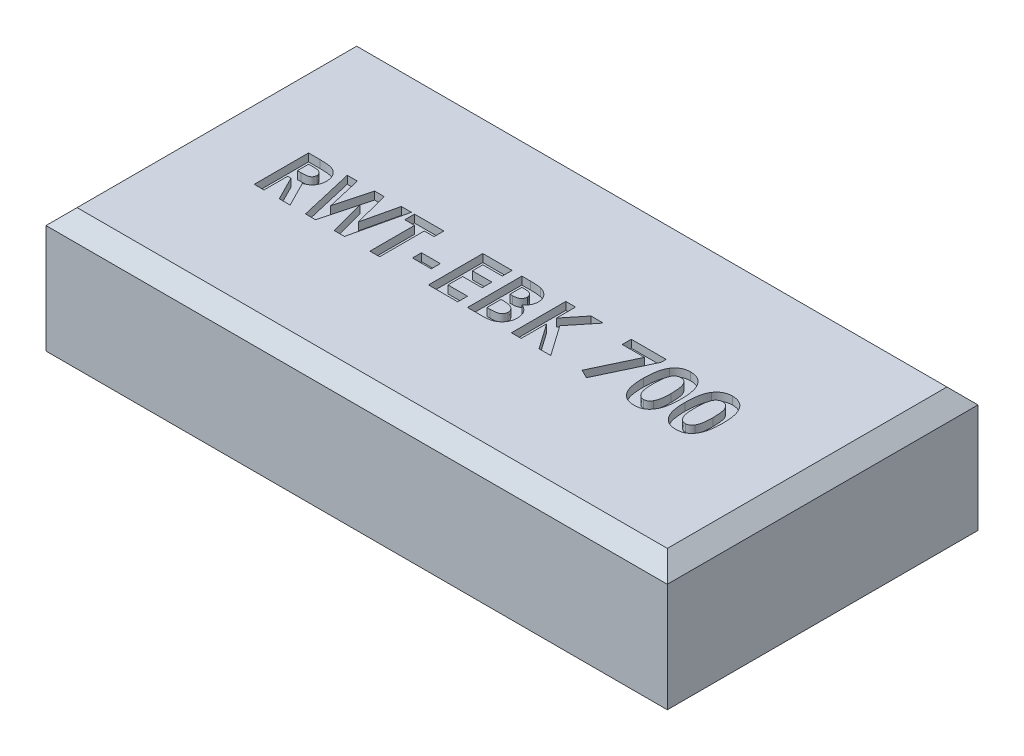
from build123d import *

# Parameters (mm, degrees)
SKETCH1_W           = 40
SKETCH1_H           = 20
BOSS_EXTRUDE1_DEPTH = 8
CHAMFER1_SIZE       = 1
SKETCH4_W           = 1.211538461
SKETCH4_H           = 0.583333333
CUT_EXTRUDE3_DEPTH  = 0.5


with BuildPart() as part:
    # Sketch1 → Boss-Extrude1 (new body)
    with BuildSketch(Plane(origin=(0, 0, 0), x_dir=(1, 0, 0), z_dir=(0, 1, 0))):
        with Locations((0, 2.318501171)):
            Rectangle(SKETCH1_W, SKETCH1_H)
    extrude(amount=BOSS_EXTRUDE1_DEPTH)

    # Chamfer1
    chamfer1_edges = [part.edges().sort_by_distance(p)[0] for p in [
        (0, 8, 7.681498829),
        (-20, 8, -2.318501171),
        (0, 8, -12.318501171),
        (20, 8, -2.318501171),
    ]]
    chamfer(chamfer1_edges, length=CHAMFER1_SIZE)

    # Sketch4 → Cut-Extrude3 (cut)
    # profile 1 of 10: a face of its own
    with BuildSketch(Plane(origin=(0, 8, 0), x_dir=(1, 0, 0), z_dir=(0, 1, 0))):
        with BuildLine():
            Line((-14.596153846, 3.818501171), (-13.864182692, 3.818501171))
            add(Edge.make_bspline(
                [(-13.864182692, 3.818501171), (-13.815799622, 3.818329439), (-13.722745349, 3.81799915), (-13.588566169, 3.81278806), (-13.46530414, 3.805536401), (-13.352776761, 3.794470177), (-13.251032173, 3.779797701), (-13.159968404, 3.76250128), (-13.079588115, 3.742788301), (-13.009213411, 3.718224373), (-12.945703721, 3.690516634), (-12.886503859, 3.658679935), (-12.830307791, 3.623068786), (-12.777491125, 3.582746162), (-12.727594872, 3.538437457), (-12.6805249, 3.49009807), (-12.636946351, 3.437318103), (-12.597129066, 3.380431058), (-12.560838815, 3.320587191), (-12.528765845, 3.257704336), (-12.502684052, 3.191738763), (-12.479637993, 3.123643816), (-12.463038663, 3.052446065), (-12.451494071, 2.978838632), (-12.443041573, 2.902562411), (-12.442555595, 2.850743733), (-12.442307692, 2.824310466)],
                knots=[0, 0, 0, 0, 1.749336639, 3.364467119, 4.854658419, 6.213483162, 7.451590619, 8.570285859, 9.5643256, 10.440900261, 11.26203566, 12.067320669, 12.869050712, 13.665104639, 14.467235401, 15.27997916, 16.102287765, 16.939272006, 17.78853747, 18.631303466, 19.488103222, 20.351255419, 21.228522269, 22.127379805, 23.044756219, 24, 24, 24, 24], degree=3))
            add(Edge.make_bspline(
                [(-12.442307692, 2.824310466), (-12.442951654, 2.796720207), (-12.444214347, 2.742620739), (-12.451015895, 2.663153032), (-12.46344699, 2.587123888), (-12.48227569, 2.514755912), (-12.503916836, 2.4451484), (-12.532694008, 2.379585653), (-12.565171892, 2.317114157), (-12.603744925, 2.258617595), (-12.646076944, 2.20279664), (-12.695308193, 2.151790002), (-12.748249241, 2.102856265), (-12.807876098, 2.059060474), (-12.871560358, 2.017441316), (-12.940567358, 1.979723274), (-13.014446736, 1.944958206), (-13.066387598, 1.925570802), (-13.092948718, 1.91565662)],
                knots=[0, 0, 0, 0, 1.099860209, 2.156625411, 3.176576793, 4.16617041, 5.135385252, 6.078461593, 7.016046972, 7.938469504, 8.868247731, 9.803980173, 10.76021508, 11.73834243, 12.748633912, 13.790971185, 14.870363756, 16, 16, 16, 16], degree=3))
            Line((-13.092948718, 1.91565662), (-12.28525641, 0.318501171))
            Line((-12.28525641, 0.318501171), (-12.983573718, 0.318501171))
            Line((-12.983573718, 0.318501171), (-13.754807692, 1.844142197))
            Line((-13.754807692, 1.844142197), (-13.967948718, 1.844142197))
            Line((-13.967948718, 1.844142197), (-13.967948718, 0.318501171))
            Line((-13.967948718, 0.318501171), (-14.596153846, 0.318501171))
            Line((-14.596153846, 0.318501171), (-14.596153846, 3.818501171))
        make_face()
        with BuildLine():
            Line((-13.967948718, 2.472347325), (-13.723257212, 2.472347325))
            add(Edge.make_bspline(
                [(-13.723257212, 2.472347325), (-13.693341641, 2.472684254), (-13.636059751, 2.473329401), (-13.55368087, 2.476321861), (-13.4788612, 2.483532211), (-13.41127944, 2.492642218), (-13.350595524, 2.503161037), (-13.297350732, 2.518235143), (-13.250724642, 2.534387429), (-13.211269776, 2.554460531), (-13.177560445, 2.577288002), (-13.148454596, 2.603220576), (-13.124379885, 2.633234229), (-13.104565169, 2.666513318), (-13.089151475, 2.70335219), (-13.07790066, 2.743346436), (-13.071613117, 2.786951643), (-13.070889714, 2.817045173), (-13.070512821, 2.832723927)],
                knots=[0, 0, 0, 0, 1.688639943, 3.233382647, 4.650958383, 5.928841754, 7.082724185, 8.122798841, 9.049171256, 9.863274652, 10.613301712, 11.341792392, 12.054588806, 12.776240173, 13.521029143, 14.301969904, 15.115324896, 16, 16, 16, 16], degree=3))
            add(Edge.make_bspline(
                [(-13.070512821, 2.832723927), (-13.071225372, 2.851273039), (-13.072625049, 2.88770933), (-13.086514186, 2.940164814), (-13.108622693, 2.988715953), (-13.1389274, 3.033143381), (-13.177092239, 3.072091531), (-13.220889403, 3.106424636), (-13.27126414, 3.133572687), (-13.317907356, 3.151479252), (-13.36034178, 3.162192934), (-13.398637509, 3.170176676), (-13.442984193, 3.175834983), (-13.493415313, 3.181836624), (-13.549802317, 3.185728385), (-13.612452548, 3.188568594), (-13.681186076, 3.189730664), (-13.729099873, 3.190102157), (-13.754106571, 3.190296043)],
                knots=[0, 0, 0, 0, 1.020303359, 2.004196876, 2.966617323, 3.9489082, 4.950758222, 5.960522915, 7.003732012, 8.091992268, 8.70421221, 9.413913587, 10.24622431, 11.166358409, 12.212345909, 13.359657661, 14.621978493, 16, 16, 16, 16], degree=3))
            Line((-13.754106571, 3.190296043), (-13.967948718, 3.190296043))
            Line((-13.967948718, 3.190296043), (-13.967948718, 2.472347325))
        make_face(mode=Mode.SUBTRACT)
    # profile 2 of 10: a face of its own
    with BuildSketch(Plane(origin=(0, 8, 0), x_dir=(1, 0, 0), z_dir=(0, 1, 0))):
        Polygon((-12.105769231, 3.818501171), (-11.457231571, 3.818501171), (-10.939102564, 1.584026011), (-10.345252404, 3.818501171), (-9.734575321, 3.818501171), (-9.144230769, 1.584026011), (-8.627504006, 3.818501171), (-7.977564103, 3.818501171), (-8.787359776, 0.318501171), (-9.443609776, 0.318501171), (-10.041666667, 2.581021203), (-10.643229167, 0.318501171), (-11.294571314, 0.318501171), align=None)
    # profile 3 of 10: a face of its own
    with BuildSketch(Plane(origin=(0, 8, 0), x_dir=(1, 0, 0), z_dir=(0, 1, 0))):
        Polygon((-7.775641026, 3.818501171), (-5.891025641, 3.818501171), (-5.891025641, 3.190296043), (-6.519230769, 3.190296043), (-6.519230769, 0.318501171), (-7.147435897, 0.318501171), (-7.147435897, 3.190296043), (-7.775641026, 3.190296043), align=None)
    # profile 4 of 10: a face of its own
    with BuildSketch(Plane(origin=(0, 8, 0), x_dir=(1, 0, 0), z_dir=(0, 1, 0))):
        with Locations((-4.791666667, 1.597347325)):
            Rectangle(SKETCH4_W, SKETCH4_H)
    # profile 5 of 10: a face of its own
    with BuildSketch(Plane(origin=(0, 8, 0), x_dir=(1, 0, 0), z_dir=(0, 1, 0))):
        Polygon((-3.378205128, 3.818501171), (-1.493589744, 3.818501171), (-1.493589744, 3.190296043), (-2.75, 3.190296043), (-2.75, 2.51721912), (-1.493589744, 2.51721912), (-1.493589744, 1.889013991), (-2.75, 1.889013991), (-2.75, 0.946706299), (-1.493589744, 0.946706299), (-1.493589744, 0.318501171), (-3.378205128, 0.318501171), align=None)
    # profile 6 of 10: a face of its own
    with BuildSketch(Plane(origin=(0, 8, 0), x_dir=(1, 0, 0), z_dir=(0, 1, 0))):
        with BuildLine():
            Line((-0.865384615, 0.318501171), (-0.865384615, 3.818501171))
            Line((-0.865384615, 3.818501171), (-0.304487179, 3.818501171))
            add(Edge.make_bspline(
                [(-0.304487179, 3.818501171), (-0.265220852, 3.818505652), (-0.189241252, 3.818514323), (-0.079622519, 3.814664873), (0.022039599, 3.809685178), (0.115421572, 3.804114058), (0.200682344, 3.794513904), (0.277692262, 3.784396391), (0.346605192, 3.772195293), (0.389210312, 3.76125053), (0.409254808, 3.756101331)],
                knots=[0, 0, 0, 0, 1.311965854, 2.538629056, 3.664479157, 4.713267157, 5.663616078, 6.530575999, 7.308677837, 8, 8, 8, 8], degree=3))
            add(Edge.make_bspline(
                [(0.409254808, 3.756101331), (0.435575266, 3.748838294), (0.487224455, 3.734585883), (0.561202576, 3.705802524), (0.631381143, 3.673807779), (0.697674471, 3.637307759), (0.759675491, 3.595861807), (0.817148578, 3.549140995), (0.871333285, 3.499020694), (0.920305637, 3.444104065), (0.964568575, 3.386074475), (1.003025131, 3.324947127), (1.03643895, 3.2616567), (1.063178757, 3.195406725), (1.083326699, 3.126502301), (1.09806282, 3.055237661), (1.107613822, 2.981387306), (1.108516267, 2.931144495), (1.108974359, 2.905640594)],
                knots=[0, 0, 0, 0, 1.099996261, 2.158545794, 3.195537121, 4.207578794, 5.205712374, 6.197378256, 7.190519799, 8.17788031, 9.159561366, 10.129234751, 11.085776129, 12.040971148, 13.00380137, 13.975669004, 14.972423361, 16, 16, 16, 16], degree=3))
            add(Edge.make_bspline(
                [(1.108974359, 2.905640594), (1.107776583, 2.872874775), (1.105418909, 2.808379286), (1.090357925, 2.713647082), (1.062116233, 2.624111532), (1.025162666, 2.538122532), (0.974917368, 2.456000819), (0.911115557, 2.377785442), (0.834790614, 2.30106803), (0.776245169, 2.255081117), (0.745793269, 2.231161427)],
                knots=[0, 0, 0, 0, 0.986156485, 1.941127874, 2.875419072, 3.804401753, 4.751181392, 5.761612777, 6.835722519, 8, 8, 8, 8], degree=3))
            add(Edge.make_bspline(
                [(0.745793269, 2.231161427), (0.770470028, 2.218564156), (0.818854324, 2.193864392), (0.887545811, 2.153265354), (0.951146629, 2.110083128), (1.009941945, 2.065186558), (1.062698461, 2.016672412), (1.111594582, 1.967336144), (1.154218027, 1.914350989), (1.192333195, 1.85960544), (1.225462281, 1.802306775), (1.254314061, 1.742551757), (1.278684124, 1.680136252), (1.299321324, 1.615377904), (1.314712554, 1.548053973), (1.324747963, 1.478140383), (1.332431699, 1.405875574), (1.333029422, 1.35665059), (1.333333333, 1.331622165)],
                knots=[0, 0, 0, 0, 1.164658916, 2.283573913, 3.35186032, 4.395461096, 5.390182219, 6.362969632, 7.312859996, 8.245001507, 9.165155236, 10.092416118, 11.032087915, 11.979892451, 12.947605196, 13.931445124, 14.948243989, 16, 16, 16, 16], degree=3))
            add(Edge.make_bspline(
                [(1.333333333, 1.331622165), (1.331361149, 1.283819302), (1.327469051, 1.189480545), (1.29901193, 1.050969584), (1.249676325, 0.91964863), (1.18342878, 0.796039608), (1.101799059, 0.683720797), (1.007948289, 0.585330494), (0.902821331, 0.502045287), (0.805829006, 0.445834233), (0.721938284, 0.40811136), (0.652453165, 0.384788701), (0.577827621, 0.363182624), (0.49669469, 0.348010391), (0.410525202, 0.334123096), (0.318478999, 0.325548791), (0.220728113, 0.319738197), (0.153588579, 0.318921849), (0.118990385, 0.318501171)],
                knots=[0, 0, 0, 0, 1.284142165, 2.534249414, 3.780121997, 5.041676246, 6.291546858, 7.49970053, 8.684500223, 9.883330709, 10.50184324, 11.153274765, 11.851151195, 12.587658647, 13.369265475, 14.195992086, 15.070362669, 16, 16, 16, 16], degree=3))
            Line((0.118990385, 0.318501171), (-0.865384615, 0.318501171))
        make_face()
        with BuildLine():
            Line((-0.237179487, 3.190296043), (-0.237179487, 2.42747553))
            Line((-0.237179487, 2.42747553), (-0.0703125, 2.42747553))
            add(Edge.make_bspline(
                [(-0.0703125, 2.42747553), (-0.047633777, 2.427673297), (-0.003853875, 2.428055074), (0.059381549, 2.432972233), (0.118180282, 2.441361212), (0.172319311, 2.453065948), (0.222302963, 2.467929257), (0.267811927, 2.485813017), (0.308646108, 2.507633149), (0.356085982, 2.540135198), (0.406233349, 2.587963419), (0.450377513, 2.657061193), (0.476378131, 2.736523371), (0.479273899, 2.792566252), (0.480769231, 2.821505979)],
                knots=[0, 0, 0, 0, 1.065314748, 2.056525647, 2.977365736, 3.853934255, 4.656397591, 5.425096493, 6.14721249, 6.826394842, 8.123232004, 9.372140726, 10.643011755, 12, 12, 12, 12], degree=3))
            add(Edge.make_bspline(
                [(0.480769231, 2.821505979), (0.479572691, 2.848612841), (0.47725923, 2.901022871), (0.451079951, 2.97461122), (0.410418355, 3.039825558), (0.362411626, 3.084459439), (0.317203962, 3.114943064), (0.278494386, 3.135015233), (0.236007719, 3.152983634), (0.188921466, 3.166722711), (0.137504514, 3.17703203), (0.082006625, 3.184602991), (0.022332045, 3.189756109), (-0.018885315, 3.190112204), (-0.040164263, 3.190296043)],
                knots=[0, 0, 0, 0, 1.347982417, 2.606269829, 3.849316587, 5.153353503, 5.842674298, 6.568177932, 7.326619318, 8.142485038, 9.012069166, 9.942760135, 10.937925643, 12, 12, 12, 12], degree=3))
            Line((-0.040164263, 3.190296043), (-0.237179487, 3.190296043))
        make_face(mode=Mode.SUBTRACT)
        with BuildLine():
            Line((-0.237179487, 1.844142197), (-0.237179487, 0.946706299))
            Line((-0.237179487, 0.946706299), (-0.056290064, 0.946706299))
            add(Edge.make_bspline(
                [(-0.056290064, 0.946706299), (-0.020527995, 0.946910607), (0.048229046, 0.947303413), (0.146723385, 0.952049449), (0.236279363, 0.960603342), (0.316659689, 0.971282188), (0.387987483, 0.985750355), (0.450021639, 1.004144774), (0.503612874, 1.02438184), (0.548439854, 1.049377018), (0.585060929, 1.078465208), (0.618107609, 1.108194036), (0.645051813, 1.142489048), (0.666370569, 1.179878054), (0.684821916, 1.219432285), (0.695950465, 1.262696318), (0.704423352, 1.308387911), (0.704889637, 1.339991798), (0.705128205, 1.356161427)],
                knots=[0, 0, 0, 0, 1.753078804, 3.370512758, 4.83203934, 6.162291463, 7.344201807, 8.395507345, 9.331626367, 10.147333109, 10.898971645, 11.62040215, 12.321813352, 13.025280112, 13.727906689, 14.453419512, 15.208716525, 16, 16, 16, 16], degree=3))
            add(Edge.make_bspline(
                [(0.705128205, 1.356161427), (0.704602095, 1.374651653), (0.703577374, 1.410665639), (0.695208464, 1.463303922), (0.67999942, 1.512445252), (0.660842888, 1.559346239), (0.634185556, 1.602327663), (0.602504228, 1.642876951), (0.564225095, 1.679620976), (0.521177978, 1.714782156), (0.470967777, 1.745567673), (0.413570936, 1.772279563), (0.348675643, 1.79458835), (0.27608088, 1.81235062), (0.196104895, 1.827425213), (0.108163951, 1.83642641), (0.012990452, 1.843120995), (-0.053004401, 1.843794061), (-0.087139423, 1.844142197)],
                knots=[0, 0, 0, 0, 0.845221588, 1.646264278, 2.427170338, 3.19324141, 3.95557735, 4.731569926, 5.540061037, 6.376114724, 7.268642756, 8.224665384, 9.265483498, 10.400594375, 11.639216012, 12.983232105, 14.439614077, 16, 16, 16, 16], degree=3))
            Line((-0.087139423, 1.844142197), (-0.237179487, 1.844142197))
        make_face(mode=Mode.SUBTRACT)
    # profile 7 of 10: a face of its own
    with BuildSketch(Plane(origin=(0, 8, 0), x_dir=(1, 0, 0), z_dir=(0, 1, 0))):
        Polygon((1.961538462, 3.818501171), (2.58974359, 3.818501171), (2.58974359, 2.586630177), (3.582532051, 3.818501171), (4.375500801, 3.818501171), (3.128205128, 2.270424248), (4.496794872, 0.318501171), (3.740284455, 0.318501171), (2.58974359, 1.959827293), (2.58974359, 0.318501171), (1.961538462, 0.318501171), align=None)
    # profile 8 of 10: a face of its own
    with BuildSketch(Plane(origin=(0, 8, 0), x_dir=(1, 0, 0), z_dir=(0, 1, 0))):
        Polygon((6.179487179, 3.818501171), (8.423076923, 3.818501171), (8.423076923, 3.492479536), (6.879206731, 0.228757581), (6.322516026, 0.509206299), (7.612580128, 3.235167838), (6.179487179, 3.235167838), align=None)
    # profile 9 of 10: a face of its own
    with BuildSketch(Plane(origin=(0, 8, 0), x_dir=(1, 0, 0), z_dir=(0, 1, 0))):
        with BuildLine():
            add(Edge.make_bspline(
                [(9.915765224, 3.908244761), (9.94617296, 3.907793349), (10.005962692, 3.906905754), (10.094021714, 3.897292372), (10.178846898, 3.882769234), (10.260770092, 3.86251452), (10.339201605, 3.835708128), (10.414712276, 3.803621336), (10.48640331, 3.764571127), (10.555188998, 3.720461909), (10.621042843, 3.670524021), (10.682382094, 3.613592251), (10.740326935, 3.550976601), (10.793623075, 3.481730434), (10.843450772, 3.406483618), (10.889646302, 3.325224221), (10.931856026, 3.237554532), (10.970553014, 3.143316345), (11.005155982, 3.04109707), (11.03430202, 2.929724208), (11.059299625, 2.809172324), (11.080399367, 2.679141347), (11.096347361, 2.539458435), (11.107096631, 2.390216385), (11.114473288, 2.231702915), (11.115075319, 2.122963977), (11.115384615, 2.067098927)],
                knots=[0, 0, 0, 0, 0.879237366, 1.728815576, 2.559023295, 3.367336655, 4.166867292, 4.954216142, 5.737608147, 6.525189134, 7.316157332, 8.124696809, 8.942788509, 9.781158001, 10.649253743, 11.551476218, 12.482711956, 13.461909668, 14.496590415, 15.601789533, 16.789733467, 18.056700938, 19.410929216, 20.8549011, 22.384193279, 24, 24, 24, 24], degree=3))
            add(Edge.make_bspline(
                [(11.115384615, 2.067098927), (11.11505035, 2.010534943), (11.114400879, 1.900632136), (11.10740328, 1.740668821), (11.095353086, 1.590343185), (11.079821925, 1.449670779), (11.058548484, 1.31872589), (11.033634327, 1.19716946), (11.004028228, 1.085045549), (10.968285448, 0.982606796), (10.929822694, 0.888203106), (10.887497509, 0.800704352), (10.842047614, 0.71987354), (10.794515494, 0.644491226), (10.742295263, 0.576779642), (10.687928626, 0.514436242), (10.629048363, 0.459835764), (10.568133562, 0.410164346), (10.502952665, 0.367238273), (10.434177868, 0.329695837), (10.360583034, 0.299244462), (10.283509672, 0.272759483), (10.201644051, 0.253746125), (10.116287005, 0.238659651), (10.026474869, 0.23032194), (9.96532715, 0.229287592), (9.933994391, 0.228757581)],
                knots=[0, 0, 0, 0, 1.643780988, 3.193836972, 4.651895693, 6.025988579, 7.305620092, 8.505800249, 9.631074763, 10.672816429, 11.65661981, 12.592235626, 13.49536222, 14.350718032, 15.179365177, 15.97804903, 16.751647189, 17.51006938, 18.259804725, 19.016521909, 19.783502495, 20.571750527, 21.382245291, 22.22305063, 23.089471752, 24, 24, 24, 24], degree=3))
            add(Edge.make_bspline(
                [(9.933994391, 0.228757581), (9.902662478, 0.229297816), (9.841283721, 0.230356128), (9.751228725, 0.238597657), (9.665419329, 0.253807241), (9.58290602, 0.272905453), (9.504263076, 0.299185861), (9.429113408, 0.330548319), (9.358034851, 0.367856509), (9.2908306, 0.410882596), (9.227730109, 0.460221675), (9.167752798, 0.515346009), (9.111031339, 0.576115872), (9.058428606, 0.643211936), (9.00908312, 0.71573861), (8.963509474, 0.794524112), (8.921735059, 0.879453732), (8.882453162, 0.970645855), (8.848322166, 1.070063741), (8.817947164, 1.17859518), (8.793064761, 1.297144871), (8.773052668, 1.425674728), (8.757075024, 1.563912456), (8.745189494, 1.711924777), (8.738153027, 1.869780633), (8.737510367, 1.978282826), (8.737179487, 2.034146203)],
                knots=[0, 0, 0, 0, 0.917216111, 1.796812873, 2.643793957, 3.46689424, 4.273913431, 5.068098542, 5.848489301, 6.620921603, 7.401012384, 8.190319798, 9.003608147, 9.831726257, 10.68377682, 11.569763213, 12.493818149, 13.453288342, 14.474581811, 15.568529029, 16.750744269, 18.018426408, 19.375425659, 20.823733699, 22.36466933, 24, 24, 24, 24], degree=3))
            add(Edge.make_bspline(
                [(8.737179487, 2.034146203), (8.737778845, 2.111763968), (8.738935314, 2.261528446), (8.753590934, 2.477894573), (8.775101668, 2.677887577), (8.80669584, 2.861172919), (8.845761597, 3.028429436), (8.895787333, 3.178555327), (8.952737994, 3.313627923), (9.001267274, 3.393645742), (9.024639423, 3.432183062)],
                knots=[0, 0, 0, 0, 1.288568992, 2.486310467, 3.599230591, 4.627010532, 5.572937695, 6.447898582, 7.252493626, 8, 8, 8, 8], degree=3))
            add(Edge.make_bspline(
                [(9.024639423, 3.432183062), (9.051815445, 3.470042113), (9.104949923, 3.544064019), (9.197857043, 3.641240945), (9.297673647, 3.72435141), (9.406449911, 3.791514551), (9.522465493, 3.844479409), (9.646716447, 3.881887892), (9.778743933, 3.903683818), (9.869409411, 3.906701743), (9.915765224, 3.908244761)],
                knots=[0, 0, 0, 0, 1.058512271, 2.069600068, 3.047294572, 4.004278952, 4.967380941, 5.939006123, 6.946246673, 8, 8, 8, 8], degree=3))
        make_face()
        with BuildLine():
            add(Edge.make_bspline(
                [(9.931189904, 3.280039632), (9.903701059, 3.278736716), (9.84980833, 3.276182308), (9.771607414, 3.254498986), (9.697868832, 3.221007927), (9.641777862, 3.180706674), (9.599794329, 3.142073089), (9.570460134, 3.107110952), (9.542171926, 3.068095726), (9.517186356, 3.023266856), (9.493593455, 2.974235095), (9.47053608, 2.920777869), (9.451635087, 2.861582152), (9.433065363, 2.797656056), (9.416796552, 2.727232193), (9.403166854, 2.649734927), (9.390989918, 2.564660285), (9.382496359, 2.471952543), (9.374577814, 2.371708697), (9.368901426, 2.263705442), (9.36652827, 2.147971914), (9.365773916, 2.068267952), (9.365384615, 2.027134985)],
                knots=[0, 0, 0, 0, 1.076674018, 2.110852608, 3.161083442, 4.239746716, 4.804137807, 5.395870207, 6.026861976, 6.692161227, 7.405688833, 8.16177676, 8.973626916, 9.841385931, 10.773283133, 11.807421078, 12.927755683, 14.143907515, 15.458935494, 16.872852025, 18.386167141, 20, 20, 20, 20], degree=3))
            add(Edge.make_bspline(
                [(9.365384615, 2.027134985), (9.366025357, 1.973845238), (9.367254027, 1.871658197), (9.373689226, 1.724709674), (9.386588049, 1.590974686), (9.40263158, 1.46954686), (9.425165374, 1.361213689), (9.451091964, 1.264950241), (9.483108996, 1.181983641), (9.520110846, 1.111114005), (9.561092062, 1.050825352), (9.605578975, 0.999579726), (9.652056964, 0.955203432), (9.70197676, 0.919157115), (9.755219267, 0.891532879), (9.81134001, 0.871663107), (9.870374652, 0.859499993), (9.910800967, 0.85781336), (9.931189904, 0.856962709)],
                knots=[0, 0, 0, 0, 1.771748488, 3.397459088, 4.888034009, 6.237357457, 7.467047327, 8.564189669, 9.548206622, 10.417051504, 11.216568818, 11.965764335, 12.669334354, 13.348544111, 14.005342236, 14.656555988, 15.322436492, 16, 16, 16, 16], degree=3))
            add(Edge.make_bspline(
                [(9.931189904, 0.856962709), (9.950879157, 0.857544788), (9.989428267, 0.858684424), (10.045641503, 0.87038264), (10.098800732, 0.889401398), (10.148745452, 0.916304766), (10.195654308, 0.950516515), (10.239298036, 0.992186986), (10.279347487, 1.041731537), (10.302680478, 1.07850092), (10.314703526, 1.097447485)],
                knots=[0, 0, 0, 0, 0.992283464, 1.942767638, 2.88273346, 3.832339453, 4.79467288, 5.803907806, 6.868395428, 8, 8, 8, 8], degree=3))
            add(Edge.make_bspline(
                [(10.314703526, 1.097447485), (10.328858639, 1.12333736), (10.358540763, 1.177626329), (10.392888969, 1.269236938), (10.421801373, 1.372558565), (10.446685858, 1.487912756), (10.463705327, 1.615754481), (10.478362473, 1.755273086), (10.485431979, 1.907171129), (10.486581872, 2.012406641), (10.487179487, 2.067098927)],
                knots=[0, 0, 0, 0, 0.710965849, 1.490837728, 2.352621235, 3.297892224, 4.334225155, 5.461620853, 6.680770821, 8, 8, 8, 8], degree=3))
            add(Edge.make_bspline(
                [(10.487179487, 2.067098927), (10.486948641, 2.122265969), (10.486504303, 2.228453106), (10.478351976, 2.380897234), (10.466999238, 2.520129644), (10.450393459, 2.645839487), (10.429027107, 2.758331932), (10.402692997, 2.857599625), (10.37164704, 2.943838204), (10.334830235, 3.016961676), (10.294053336, 3.079106596), (10.250767413, 3.132422118), (10.204789436, 3.177941565), (10.156196294, 3.215836235), (10.103863282, 3.244790606), (10.04879003, 3.265234787), (9.990863632, 3.27760283), (9.951349628, 3.279216402), (9.931189904, 3.280039632)],
                knots=[0, 0, 0, 0, 1.793836731, 3.452829483, 4.963243077, 6.335886805, 7.574563692, 8.684454726, 9.672768357, 10.54971625, 11.340229787, 12.085688095, 12.778991901, 13.440269426, 14.083255152, 14.715733572, 15.344777694, 16, 16, 16, 16], degree=3))
        make_face(mode=Mode.SUBTRACT)
    # profile 10 of 10: a face of its own
    with BuildSketch(Plane(origin=(0, 8, 0), x_dir=(1, 0, 0), z_dir=(0, 1, 0))):
        with BuildLine():
            add(Edge.make_bspline(
                [(12.608072917, 3.908244761), (12.638480652, 3.907793349), (12.698270385, 3.906905754), (12.786329406, 3.897292372), (12.871154591, 3.882769234), (12.953077785, 3.86251452), (13.031509297, 3.835708128), (13.107019968, 3.803621336), (13.178711003, 3.764571127), (13.247496691, 3.720461909), (13.313350535, 3.670524021), (13.374689786, 3.613592251), (13.432634627, 3.550976601), (13.485930767, 3.481730434), (13.535758465, 3.406483618), (13.581953994, 3.325224221), (13.624163718, 3.237554532), (13.662860706, 3.143316345), (13.697463675, 3.04109707), (13.726609713, 2.929724208), (13.751607317, 2.809172324), (13.772707059, 2.679141347), (13.788655053, 2.539458435), (13.799404323, 2.390216385), (13.80678098, 2.231702915), (13.807383012, 2.122963977), (13.807692308, 2.067098927)],
                knots=[0, 0, 0, 0, 0.879237366, 1.728815576, 2.559023295, 3.367336655, 4.166867292, 4.954216142, 5.737608147, 6.525189134, 7.316157332, 8.124696809, 8.942788509, 9.781158001, 10.649253743, 11.551476218, 12.482711956, 13.461909668, 14.496590415, 15.601789533, 16.789733467, 18.056700938, 19.410929216, 20.8549011, 22.384193279, 24, 24, 24, 24], degree=3))
            add(Edge.make_bspline(
                [(13.807692308, 2.067098927), (13.807358042, 2.010534943), (13.806708571, 1.900632136), (13.799710973, 1.740668821), (13.787660778, 1.590343185), (13.772129618, 1.449670779), (13.750856176, 1.31872589), (13.725942019, 1.19716946), (13.69633592, 1.085045549), (13.660593141, 0.982606796), (13.622130387, 0.888203106), (13.579805201, 0.800704352), (13.534355307, 0.71987354), (13.486823186, 0.644491226), (13.434602955, 0.576779642), (13.380236318, 0.514436242), (13.321356056, 0.459835764), (13.260441254, 0.410164346), (13.195260358, 0.367238273), (13.12648556, 0.329695837), (13.052890726, 0.299244462), (12.975817364, 0.272759483), (12.893951743, 0.253746125), (12.808594697, 0.238659651), (12.718782561, 0.23032194), (12.657634842, 0.229287592), (12.626302083, 0.228757581)],
                knots=[0, 0, 0, 0, 1.643780988, 3.193836972, 4.651895693, 6.025988579, 7.305620092, 8.505800249, 9.631074763, 10.672816429, 11.65661981, 12.592235626, 13.49536222, 14.350718032, 15.179365177, 15.97804903, 16.751647189, 17.51006938, 18.259804725, 19.016521909, 19.783502495, 20.571750527, 21.382245291, 22.22305063, 23.089471752, 24, 24, 24, 24], degree=3))
            add(Edge.make_bspline(
                [(12.626302083, 0.228757581), (12.59497017, 0.229297816), (12.533591414, 0.230356128), (12.443536417, 0.238597657), (12.357727022, 0.253807241), (12.275213712, 0.272905453), (12.196570768, 0.299185861), (12.1214211, 0.330548319), (12.050342543, 0.367856509), (11.983138292, 0.410882596), (11.920037802, 0.460221675), (11.86006049, 0.515346009), (11.803339031, 0.576115872), (11.750736299, 0.643211936), (11.701390812, 0.71573861), (11.655817167, 0.794524112), (11.614042751, 0.879453732), (11.574760854, 0.970645855), (11.540629858, 1.070063741), (11.510254856, 1.17859518), (11.485372454, 1.297144871), (11.46536036, 1.425674728), (11.449382717, 1.563912456), (11.437497186, 1.711924777), (11.43046072, 1.869780633), (11.429818059, 1.978282826), (11.429487179, 2.034146203)],
                knots=[0, 0, 0, 0, 0.917216111, 1.796812873, 2.643793957, 3.46689424, 4.273913431, 5.068098542, 5.848489301, 6.620921603, 7.401012384, 8.190319798, 9.003608147, 9.831726257, 10.68377682, 11.569763213, 12.493818149, 13.453288342, 14.474581811, 15.568529029, 16.750744269, 18.018426408, 19.375425659, 20.823733699, 22.36466933, 24, 24, 24, 24], degree=3))
            add(Edge.make_bspline(
                [(11.429487179, 2.034146203), (11.430086537, 2.111763968), (11.431243006, 2.261528446), (11.445898626, 2.477894573), (11.46740936, 2.677887577), (11.499003532, 2.861172919), (11.538069289, 3.028429436), (11.588095025, 3.178555327), (11.645045686, 3.313627923), (11.693574966, 3.393645742), (11.716947115, 3.432183062)],
                knots=[0, 0, 0, 0, 1.288568992, 2.486310467, 3.599230591, 4.627010532, 5.572937695, 6.447898582, 7.252493626, 8, 8, 8, 8], degree=3))
            add(Edge.make_bspline(
                [(11.716947115, 3.432183062), (11.744123137, 3.470042113), (11.797257615, 3.544064019), (11.890164735, 3.641240945), (11.989981339, 3.72435141), (12.098757603, 3.791514551), (12.214773185, 3.844479409), (12.339024139, 3.881887892), (12.471051626, 3.903683818), (12.561717103, 3.906701743), (12.608072917, 3.908244761)],
                knots=[0, 0, 0, 0, 1.058512271, 2.069600068, 3.047294572, 4.004278952, 4.967380941, 5.939006123, 6.946246673, 8, 8, 8, 8], degree=3))
        make_face()
        with BuildLine():
            add(Edge.make_bspline(
                [(12.623497596, 3.280039632), (12.596008751, 3.278736716), (12.542116023, 3.276182308), (12.463915106, 3.254498986), (12.390176524, 3.221007927), (12.334085555, 3.180706674), (12.292102022, 3.142073089), (12.262767826, 3.107110952), (12.234479618, 3.068095726), (12.209494048, 3.023266856), (12.185901148, 2.974235095), (12.162843773, 2.920777869), (12.14394278, 2.861582152), (12.125373055, 2.797656056), (12.109104244, 2.727232193), (12.095474546, 2.649734927), (12.08329761, 2.564660285), (12.074804052, 2.471952543), (12.066885506, 2.371708697), (12.061209118, 2.263705442), (12.058835962, 2.147971914), (12.058081608, 2.068267952), (12.057692308, 2.027134985)],
                knots=[0, 0, 0, 0, 1.076674018, 2.110852608, 3.161083442, 4.239746716, 4.804137807, 5.395870207, 6.026861976, 6.692161227, 7.405688833, 8.16177676, 8.973626916, 9.841385931, 10.773283133, 11.807421078, 12.927755683, 14.143907515, 15.458935494, 16.872852025, 18.386167141, 20, 20, 20, 20], degree=3))
            add(Edge.make_bspline(
                [(12.057692308, 2.027134985), (12.05833305, 1.973845238), (12.05956172, 1.871658197), (12.065996919, 1.724709674), (12.078895741, 1.590974686), (12.094939272, 1.46954686), (12.117473067, 1.361213689), (12.143399656, 1.264950241), (12.175416688, 1.181983641), (12.212418538, 1.111114005), (12.253399754, 1.050825352), (12.297886667, 0.999579726), (12.344364656, 0.955203432), (12.394284452, 0.919157115), (12.44752696, 0.891532879), (12.503647703, 0.871663107), (12.562682345, 0.859499993), (12.603108659, 0.85781336), (12.623497596, 0.856962709)],
                knots=[0, 0, 0, 0, 1.771748488, 3.397459088, 4.888034009, 6.237357457, 7.467047327, 8.564189669, 9.548206622, 10.417051504, 11.216568818, 11.965764335, 12.669334354, 13.348544111, 14.005342236, 14.656555988, 15.322436492, 16, 16, 16, 16], degree=3))
            add(Edge.make_bspline(
                [(12.623497596, 0.856962709), (12.64318685, 0.857544788), (12.681735959, 0.858684424), (12.737949195, 0.87038264), (12.791108425, 0.889401398), (12.841053145, 0.916304766), (12.887962, 0.950516515), (12.931605729, 0.992186986), (12.971655179, 1.041731537), (12.994988171, 1.07850092), (13.007011218, 1.097447485)],
                knots=[0, 0, 0, 0, 0.992283464, 1.942767638, 2.88273346, 3.832339453, 4.79467288, 5.803907806, 6.868395428, 8, 8, 8, 8], degree=3))
            add(Edge.make_bspline(
                [(13.007011218, 1.097447485), (13.021166331, 1.12333736), (13.050848455, 1.177626329), (13.085196661, 1.269236938), (13.114109066, 1.372558565), (13.13899355, 1.487912756), (13.156013019, 1.615754481), (13.170670165, 1.755273086), (13.177739671, 1.907171129), (13.178889565, 2.012406641), (13.179487179, 2.067098927)],
                knots=[0, 0, 0, 0, 0.710965849, 1.490837728, 2.352621235, 3.297892224, 4.334225155, 5.461620853, 6.680770821, 8, 8, 8, 8], degree=3))
            add(Edge.make_bspline(
                [(13.179487179, 2.067098927), (13.179256334, 2.122265969), (13.178811995, 2.228453106), (13.170659668, 2.380897234), (13.15930693, 2.520129644), (13.142701151, 2.645839487), (13.121334799, 2.758331932), (13.095000689, 2.857599625), (13.063954732, 2.943838204), (13.027137927, 3.016961676), (12.986361029, 3.079106596), (12.943075106, 3.132422118), (12.897097128, 3.177941565), (12.848503986, 3.215836235), (12.796170975, 3.244790606), (12.741097722, 3.265234787), (12.683171324, 3.27760283), (12.64365732, 3.279216402), (12.623497596, 3.280039632)],
                knots=[0, 0, 0, 0, 1.793836731, 3.452829483, 4.963243077, 6.335886805, 7.574563692, 8.684454726, 9.672768357, 10.54971625, 11.340229787, 12.085688095, 12.778991901, 13.440269426, 14.083255152, 14.715733572, 15.344777694, 16, 16, 16, 16], degree=3))
        make_face(mode=Mode.SUBTRACT)
    extrude(amount=-CUT_EXTRUDE3_DEPTH, mode=Mode.SUBTRACT)


solid = part.part
